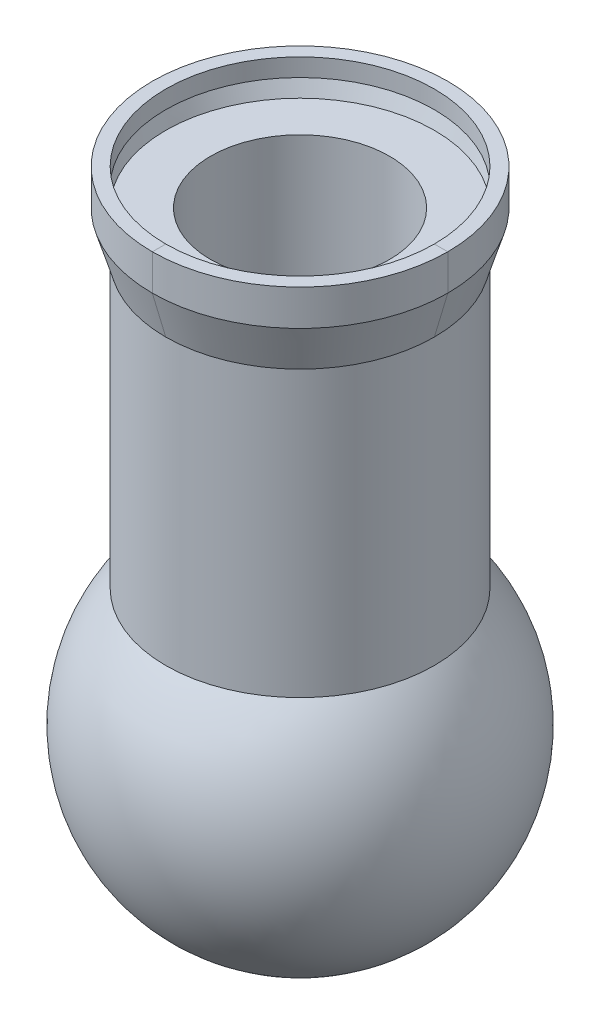
from build123d import *

# Parameters (mm, degrees)
SKETCH_3_R          = 15
EXTRUDE_1_DEPTH     = 50
SKETCH_5_R          = 10
CUT_EXTRUDE_1_DEPTH = 76.498344353


with BuildPart() as part:
    # 扫描1: sweep along a path in 草图2
    with BuildLine(Plane(origin=(0, 0, 0), x_dir=(1, 0, 0), z_dir=(0, 1, 0))) as sweep_1_path:
        CenterArc((0, 0), 10, 0, 360)
    # 草图1 → 扫描1 (sweep)
    with BuildSketch(Plane.XY):
        with BuildLine():
            Line((0, 20), (0, -20))
            ThreePointArc((0, -20), (20, 0), (0, 20))
        make_face()
    sweep(path=sweep_1_path.line)

    # 草图3 → 凸台-拉伸1 (add)
    with BuildSketch(Plane(origin=(0, 0, 0), x_dir=(1, 0, 0), z_dir=(0, 1, 0))):
        Circle(SKETCH_3_R)
    extrude(amount=EXTRUDE_1_DEPTH)

    # 扫描2: sweep along a curve in space
    with BuildLine() as sweep_2_path:
        ThreePointArc((0, 50, 15), (10.606601718, 50, 10.606601718), (15, 50, 0))
        ThreePointArc((15, 50, 0), (10.606601718, 50, -10.606601718), (0, 50, -15))
        ThreePointArc((0, 50, -15), (-10.606601718, 50, -10.606601718), (-15, 50, 0))
        ThreePointArc((-15, 50, 0), (-10.606601718, 50, 10.606601718), (0, 50, 15))
    # 草图4 → 扫描2 (sweep)
    with BuildSketch(Plane.XY):
        Polygon((15, 52), (15.8, 52), (15, 50), (15, 45), (16.5, 50), (16.5, 54), (15, 54), align=None)
    sweep(path=sweep_2_path.line)

    # 草图5 → 切除-拉伸1 (cut, through all)
    with BuildSketch(Plane(origin=(0, 50, 0), x_dir=(1, 0, 0), z_dir=(0, 1, 0))):
        Circle(SKETCH_5_R)
    extrude(amount=-CUT_EXTRUDE_1_DEPTH, mode=Mode.SUBTRACT)


solid = part.part
